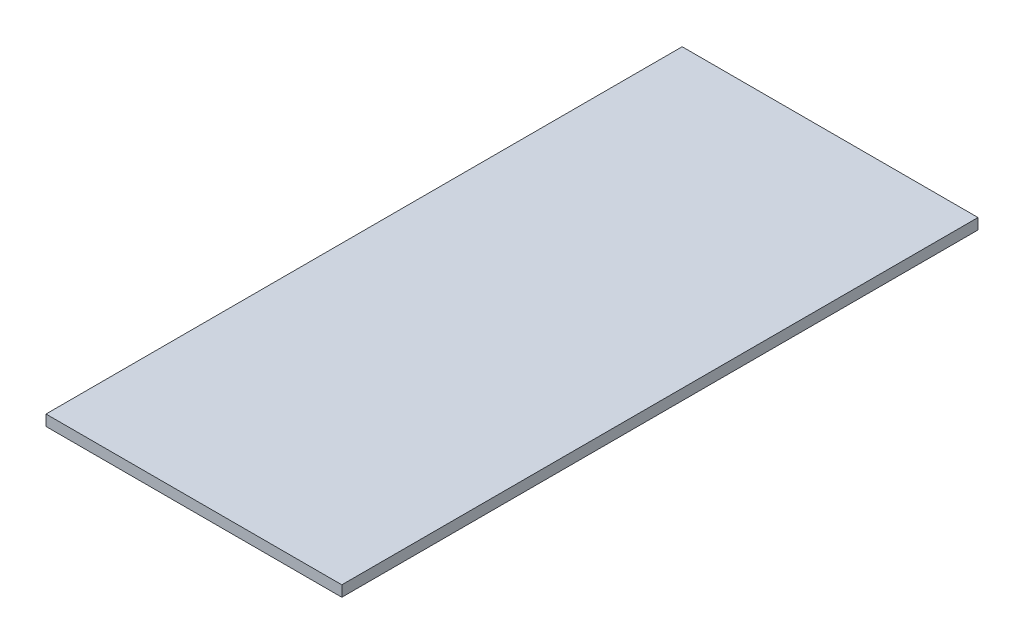
from build123d import *

# Parameters (mm, degrees)
CROQUIS1_W              = 93
CROQUIS1_H              = 200
SALIENTE_EXTRUIR1_DEPTH = 3.4


with BuildPart() as part:
    # Croquis1 → Saliente-Extruir1 (new body)
    with BuildSketch(Plane(origin=(0, 0, 0), x_dir=(1, 0, 0), z_dir=(0, 1, 0))):
        Rectangle(CROQUIS1_W, CROQUIS1_H)
    extrude(amount=SALIENTE_EXTRUIR1_DEPTH)


solid = part.part
